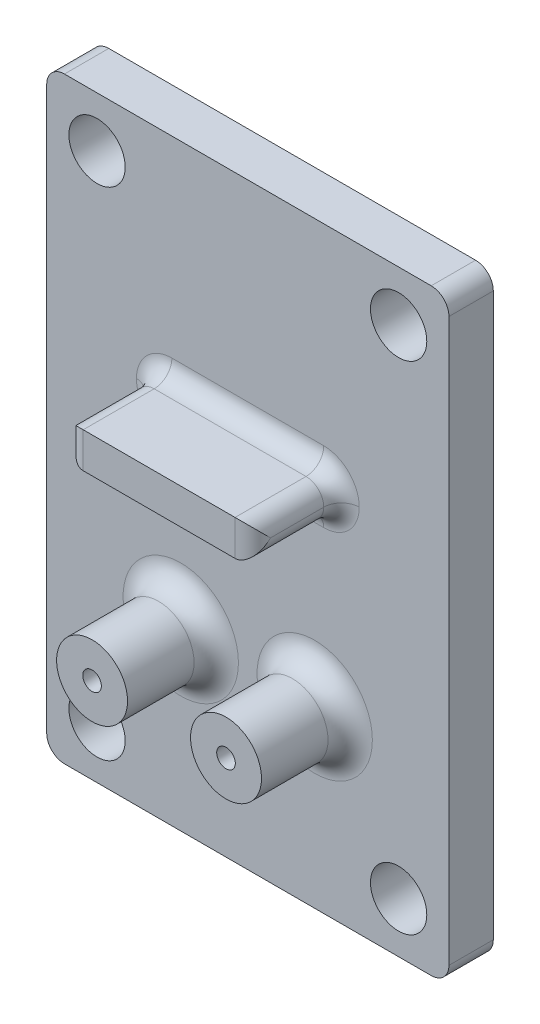
from build123d import *

# Parameters (mm, degrees)
SKETCH1_W           = 45.35
SKETCH1_H           = 67.35
SKETCH1_R           = 3.175
BOSS_EXTRUDE1_DEPTH = 5
SKETCH2_R           = 4
SKETCH2_R_2         = 1.05
SKETCH2_W           = 21.12
SKETCH2_H           = 4
BOSS_EXTRUDE2_DEPTH = 10
FILLET1_R           = 2
FILLET2_R           = 2
FILLET3_R           = 2.5


with BuildPart() as part:
    # Sketch1 → Boss-Extrude1 (new body)
    with BuildSketch(Plane.XY):
        Rectangle(SKETCH1_W, SKETCH1_H)
        with Locations((-17, 28)):
            Circle(SKETCH1_R, mode=Mode.SUBTRACT)
        with Locations((17, 28)):
            Circle(SKETCH1_R, mode=Mode.SUBTRACT)
        with Locations((17, -28)):
            Circle(SKETCH1_R, mode=Mode.SUBTRACT)
        with Locations((-17, -28)):
            Circle(SKETCH1_R, mode=Mode.SUBTRACT)
    extrude(amount=BOSS_EXTRUDE1_DEPTH)

    # Sketch2 → Boss-Extrude2 (add)
    # profile 1 of 3: a face of its own
    with BuildSketch(Plane.XY.offset(5)):
        with Locations((7.54, -14)):
            Circle(SKETCH2_R)
        with Locations((7.54, -14)):
            Circle(SKETCH2_R_2, mode=Mode.SUBTRACT)
    # profile 2 of 3: a face of its own
    with BuildSketch(Plane.XY.offset(5)):
        with Locations((-7.56, -14)):
            Circle(SKETCH2_R)
        with Locations((-7.56, -14)):
            Circle(SKETCH2_R_2, mode=Mode.SUBTRACT)
    # profile 3 of 3: a face of its own
    with BuildSketch(Plane.XY.offset(5)):
        with Locations((0, 8)):
            Rectangle(SKETCH2_W, SKETCH2_H)
    extrude(amount=BOSS_EXTRUDE2_DEPTH)

    # Fillet1
    fillet1_edges = [part.edges().sort_by_distance(p)[0] for p in [
        (22.675, -33.675, 2.5),
        (-22.675, -33.675, 2.5),
        (-22.675, 33.675, 2.5),
        (22.675, 33.675, 2.5),
    ]]
    fillet(fillet1_edges, radius=FILLET1_R)

    # Fillet2
    fillet2_edges = [part.edges().sort_by_distance(p)[0] for p in [
        (0, 6, 5),
        (-10.56, 6, 10),
        (10.56, 8, 5),
        (10.56, 6, 10),
        (10.56, 10, 10),
        (-10.56, 8, 15),
        (-10.56, 10, 10),
        (10.56, 8, 15),
        (-10.56, 8, 5),
        (0, 10, 5),
    ]]
    fillet(fillet2_edges, radius=FILLET2_R - 0.0001)  # a hair under: the kernel refuses the full size

    # Fillet3
    fillet3_edges = [part.edges().sort_by_distance(p)[0] for p in [
        (3.54, -14, 5),
        (-11.56, -14, 5),
    ]]
    fillet(fillet3_edges, radius=FILLET3_R)


solid = part.part
